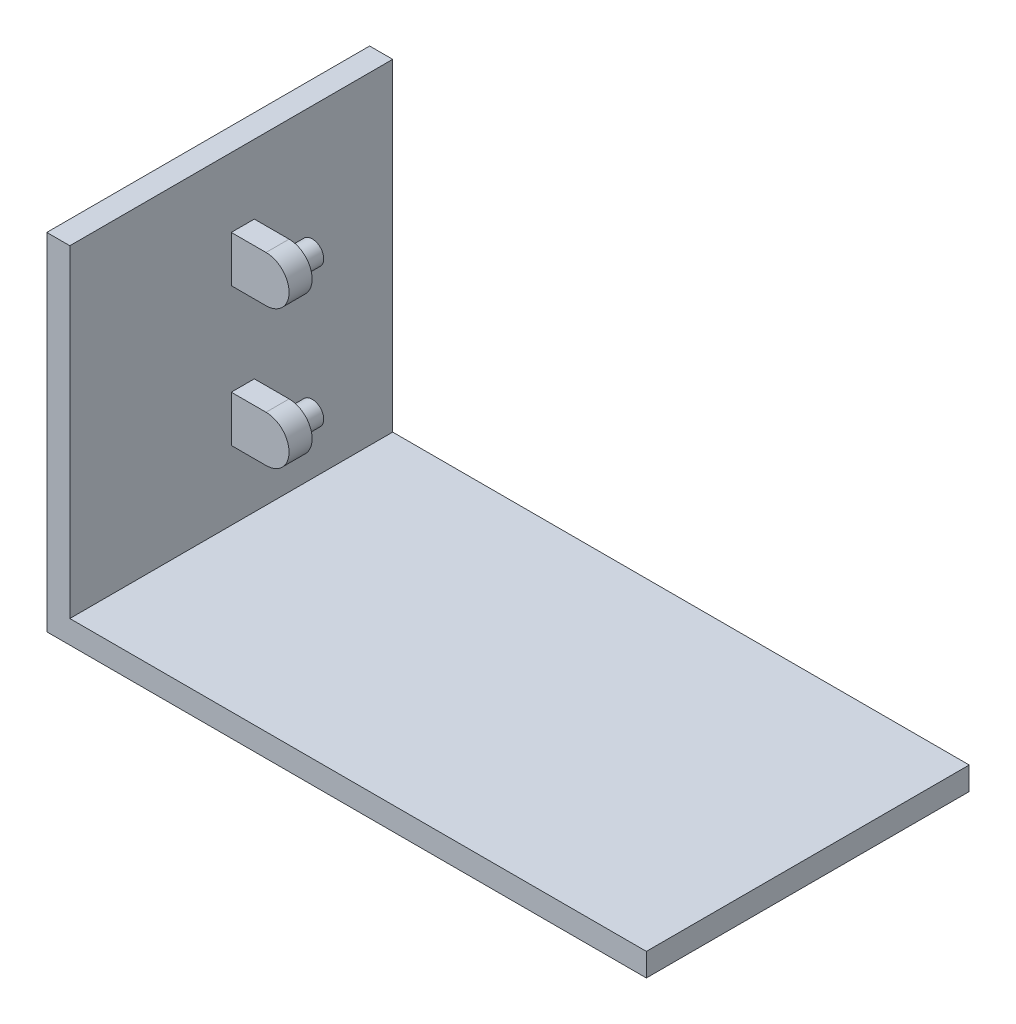
from build123d import *

# Parameters (mm, degrees)
SCHIZZO1_W                   = 5
SCHIZZO1_H                   = 70
ESTRUSIONE_ESTRUSIONE1_DEPTH = 70
ESTRUSIONE_ESTRUSIONE2_START = -35
ESTRUSIONE_ESTRUSIONE2_DEPTH = 5
SCHIZZO3_R                   = 2.5
ESTRUSIONE_ESTRUSIONE3_DEPTH = 5
SCHIZZO4_W                   = 130
SCHIZZO4_H                   = 70
ESTRUSIONE_ESTRUSIONE4_DEPTH = 5


with BuildPart() as part:
    # Schizzo1 → Estrusione-Estrusione1 (new body)
    with BuildSketch(Plane.XY):
        with Locations((-2.5, 35)):
            Rectangle(SCHIZZO1_W, SCHIZZO1_H)
    extrude(amount=ESTRUSIONE_ESTRUSIONE1_DEPTH)

    # Schizzo2 → Estrusione-Estrusione2 (add)
    with BuildSketch(Plane.XY.offset(70).offset(ESTRUSIONE_ESTRUSIONE2_START)):
        with BuildLine():
            Line((0, 55), (0, 45))
            Line((0, 45), (7.531619243, 45))
            ThreePointArc((7.531619243, 45), (12.531619243, 50), (7.531619243, 55))
            Line((7.531619243, 55), (0, 55))
        make_face()
        with BuildLine():
            Line((0, 25), (0, 15))
            Line((0, 15), (7.531619243, 15))
            ThreePointArc((7.531619243, 15), (12.531619243, 20), (7.531619243, 25))
            Line((7.531619243, 25), (0, 25))
        make_face()
    extrude(amount=-ESTRUSIONE_ESTRUSIONE2_DEPTH)

    # Schizzo3 → Estrusione-Estrusione3 (add)
    with BuildSketch(Plane(origin=(0, 0, 30), x_dir=(-1, 0, 0), z_dir=(0, 0, -1))):
        with Locations((-7.547600082, 50.061310314)):
            Circle(SCHIZZO3_R)
        with Locations((-7.547600082, 19.939772921)):
            Circle(SCHIZZO3_R)
    extrude(amount=ESTRUSIONE_ESTRUSIONE3_DEPTH)

    # Schizzo4 → Estrusione-Estrusione4 (add)
    with BuildSketch(Plane.XZ):
        with Locations((60, 35)):
            Rectangle(SCHIZZO4_W, SCHIZZO4_H)
    extrude(amount=ESTRUSIONE_ESTRUSIONE4_DEPTH)


solid = part.part
